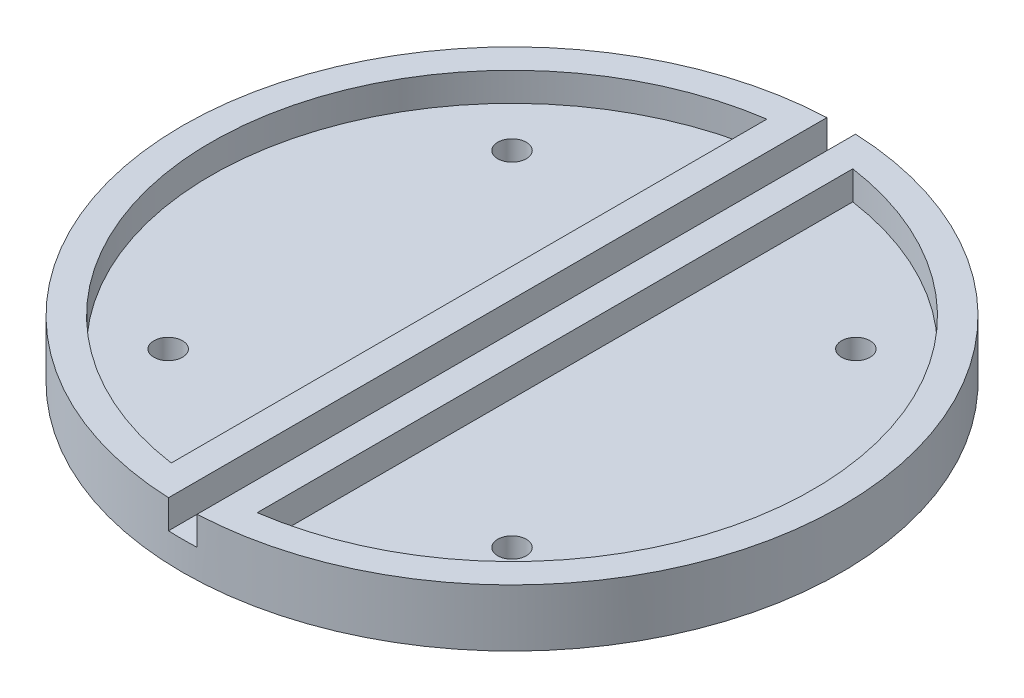
from build123d import *

# Parameters (mm, degrees)
SKETCH5_R           = 73.025
SKETCH5_R_2         = 3.175
PLATEBASE_DEPTH     = 6.35
PLATETOP_DEPTH      = 6.35
SKETCH9_R           = 73.025
SKETCH9_R_2         = 66.675
PLATEWALLS_DEPTH    = 6.35
TOPSLOTCUT_START    = -6.35
TOPSLOTCUT_DEPTH    = 6.35
BOTTOMSLOTCUT_START = -6.35
BOTTOMSLOTCUT_DEPTH = 6.35


with BuildPart() as part:
    # Sketch5 → PlateBase (new body)
    with BuildSketch(Plane(origin=(0, 0, 0), x_dir=(1, 0, 0), z_dir=(0, 1, 0))):
        Circle(SKETCH5_R)
        with Locations((38.1, 38.1)):
            Circle(SKETCH5_R_2, mode=Mode.SUBTRACT)
        with Locations((38.1, -38.1)):
            Circle(SKETCH5_R_2, mode=Mode.SUBTRACT)
        with Locations((-38.1, 38.1)):
            Circle(SKETCH5_R_2, mode=Mode.SUBTRACT)
        with Locations((-38.1, -38.1)):
            Circle(SKETCH5_R_2, mode=Mode.SUBTRACT)
    extrude(amount=PLATEBASE_DEPTH)

    # Sketch6 → PlateTop (add)
    with BuildSketch(Plane(origin=(0, 6.35, 0), x_dir=(1, 0, 0), z_dir=(0, 1, 0))):
        with BuildLine():
            Line((3.175, 72.955945611), (3.175, -72.955945611))
            ThreePointArc((3.175, -72.955945611), (6.35605636, -72.747860261), (9.525, -72.401139494))
            Line((9.525, -72.401139494), (9.525, 72.401139494))
            ThreePointArc((9.525, 72.401139494), (6.35605636, 72.747860261), (3.175, 72.955945611))
        make_face()
        with BuildLine():
            Line((-3.175, -72.955945611), (-3.175, 72.955945611))
            ThreePointArc((-3.175, 72.955945611), (-6.35605636, 72.747860261), (-9.525, 72.401139494))
            Line((-9.525, 72.401139494), (-9.525, -72.401139494))
            ThreePointArc((-9.525, -72.401139494), (-6.35605636, -72.747860261), (-3.175, -72.955945611))
        make_face()
    extrude(amount=PLATETOP_DEPTH)

    # Sketch9 → PlateWalls (add)
    with BuildSketch(Plane(origin=(0, 6.35, 0), x_dir=(1, 0, 0), z_dir=(0, 1, 0))):
        Circle(SKETCH9_R)
        Circle(SKETCH9_R_2, mode=Mode.SUBTRACT)
    extrude(amount=PLATEWALLS_DEPTH)

    # Sketch11 → TopSlotCut (cut)
    with BuildSketch(Plane(origin=(0, 12.7, 0), x_dir=(1, 0, 0), z_dir=(0, 1, 0)).offset(TOPSLOTCUT_START)):
        with BuildLine():
            Line((-3.175, 66.599361859), (-3.175, 72.955945611))
            ThreePointArc((-3.175, 72.955945611), (0, 73.025), (3.175, 72.955945611))
            Line((3.175, 72.955945611), (3.175, 66.599361859))
            Line((3.175, 66.599361859), (-3.175, 66.599361859))
        make_face()
    extrude(amount=TOPSLOTCUT_DEPTH, mode=Mode.SUBTRACT)

    # Sketch12 → BottomSlotCut (cut)
    with BuildSketch(Plane(origin=(0, 12.7, 0), x_dir=(1, 0, 0), z_dir=(0, 1, 0)).offset(BOTTOMSLOTCUT_START)):
        with BuildLine():
            Line((-3.175, -66.599361859), (-3.175, -72.955945611))
            ThreePointArc((-3.175, -72.955945611), (0, -73.025), (3.175, -72.955945611))
            Line((3.175, -72.955945611), (3.175, -66.599361859))
            Line((3.175, -66.599361859), (-3.175, -66.599361859))
        make_face()
    extrude(amount=BOTTOMSLOTCUT_DEPTH, mode=Mode.SUBTRACT)


solid = part.part
